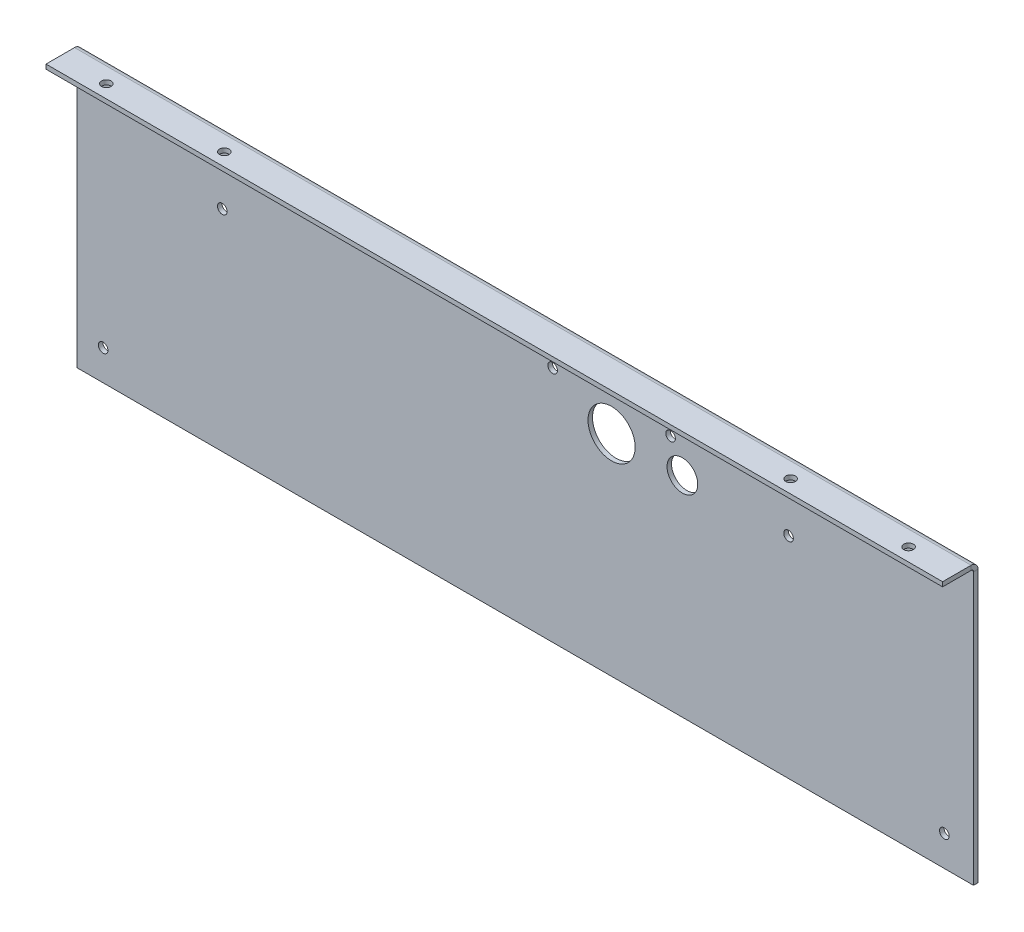
from build123d import *

# Parameters (mm, degrees)
SKETCH1_W                    = 380
SKETCH1_H                    = 118
BASE_FLANGE1_DEPTH           = 1.9
EDGE_FLANGE1_STRIP_W         = 9.6
EDGE_FLANGE1_STRIP_H         = 1.9
EDGE_FLANGE1_STRIP_CUT_DEPTH = 380
EDGE_FLANGE1_DEPTH           = 380
SKETCH9_R                    = 10
SKETCH9_R_2                  = 2.04
CUT_EXTRUDE1_DEPTH           = 10
SKETCH10_R                   = 2.04
CUT_EXTRUDE2_DEPTH           = 10
SKETCH11_R                   = 2.04
CUT_EXTRUDE3_DEPTH           = 10
SKETCH12_R                   = 2.04
CUT_EXTRUDE4_DEPTH           = 10
SKETCH13_R                   = 6.5
CUT_EXTRUDE5_DEPTH           = 62


# Sheet-metal steps are written as plain solids
with BuildPart() as part:
    # Sketch1 → Base-Flange1 (new body)
    with BuildSketch(Plane.XY):
        Rectangle(SKETCH1_W, SKETCH1_H)
    extrude(amount=-BASE_FLANGE1_DEPTH)

    # Edge-Flange1 strip (across the edge) → Edge-Flange1 strip cut (cut)
    with BuildSketch(Plane(origin=(190, 59, 0), x_dir=(0, -1, 0), z_dir=(-1, 0, 0))):
        with Locations((-1.9, -0.95)):
            Rectangle(EDGE_FLANGE1_STRIP_W, EDGE_FLANGE1_STRIP_H)
    extrude(amount=EDGE_FLANGE1_STRIP_CUT_DEPTH, mode=Mode.SUBTRACT)

    # Edge-Flange1 section (across the edge) → Edge-Flange1 (add)
    with BuildSketch(Plane(origin=(190, 59, 0), x_dir=(0, -1, 0), z_dir=(-1, 0, 0))):
        with BuildLine():
            Line((0, 1), (0, 13.1))
            Line((0, 13.1), (1.9, 13.1))
            Line((1.9, 13.1), (1.9, 1))
            ThreePointArc((1.9, 1), (2.192893219, 0.292893219), (2.9, 0))
            Line((2.9, 0), (2.9, -1.9))
            ThreePointArc((2.9, -1.9), (0.849390335, -1.050609665), (0, 1))
        make_face()
    extrude(amount=EDGE_FLANGE1_DEPTH)

    # Sketch9 → Cut-Extrude1 (cut)
    with BuildSketch(Plane.XY):
        with Locations((36.610673768, 30.1)):
            Circle(SKETCH9_R)
        with Locations((-128.389326232, 30.1)):
            Circle(SKETCH9_R_2)
        with Locations((111.610673768, 30.1)):
            Circle(SKETCH9_R_2)
    extrude(amount=-CUT_EXTRUDE1_DEPTH, mode=Mode.SUBTRACT)

    # Sketch10 → Cut-Extrude2 (cut)
    with BuildSketch(Plane.XZ.offset(-57.1)):
        with Locations(Location((-170, 7.52794, 0), (0, 0, 270))):
            Circle(SKETCH10_R)
        with Locations(Location((-120, 7.52794, 0), (0, 0, 270))):
            Circle(SKETCH10_R)
        with Locations(Location((170, 7.52794, 0), (0, 0, 270))):
            Circle(SKETCH10_R)
        with Locations(Location((120, 7.52794, 0), (0, 0, 270))):
            Circle(SKETCH10_R)
    extrude(amount=-CUT_EXTRUDE2_DEPTH, mode=Mode.SUBTRACT)

    # Sketch11 → Cut-Extrude3 (cut)
    with BuildSketch(Plane(origin=(0, 0, -1.9), x_dir=(-1, 0, 0), z_dir=(0, 0, -1))):
        with Locations((178.889326232, -46.1)):
            Circle(SKETCH11_R)
        with Locations((-177.652523634, -46.1)):
            Circle(SKETCH11_R)
    extrude(amount=-CUT_EXTRUDE3_DEPTH, mode=Mode.SUBTRACT)

    # Sketch12 → Cut-Extrude4 (cut)
    with BuildSketch(Plane.XY):
        with Locations((11.610673768, 41.735559355)):
            Circle(SKETCH12_R)
        with Locations((61.610673768, 41.735559355)):
            Circle(SKETCH12_R)
    extrude(amount=-CUT_EXTRUDE4_DEPTH, mode=Mode.SUBTRACT)

    # Sketch13 → Cut-Extrude5 (cut)
    with BuildSketch(Plane.XY):
        with Locations((66.610673768, 29.7737606)):
            Circle(SKETCH13_R)
    extrude(amount=-CUT_EXTRUDE5_DEPTH, mode=Mode.SUBTRACT)


solid = part.part
